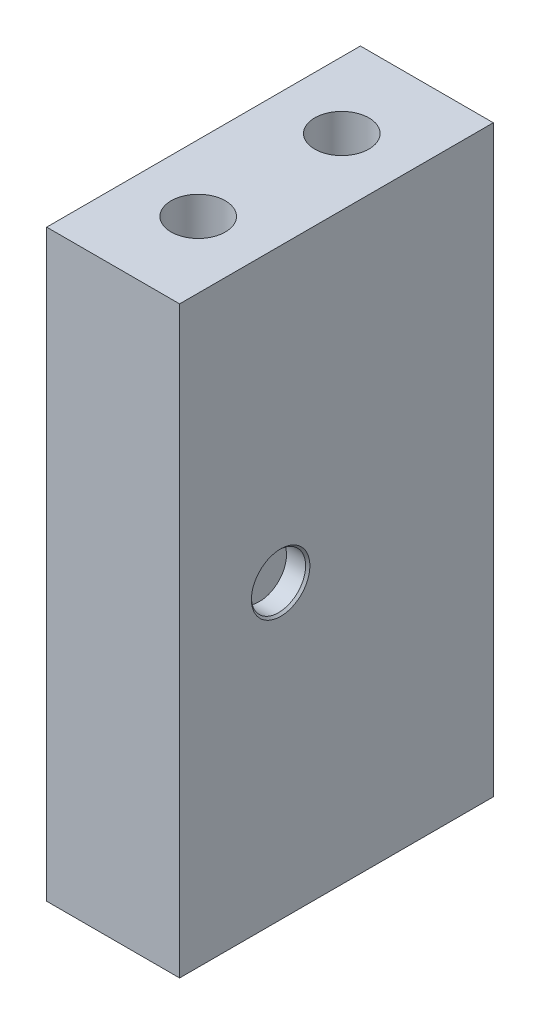
from build123d import *

# Parameters (mm, degrees)
SKETCH1_W           = 12.5
SKETCH1_H           = 29.5
SKETCH1_R           = 2.55
BOSS_EXTRUDE1_DEPTH = 27.45
SKETCH2_R           = 2.55
CUT_EXTRUDE1_DEPTH  = 2
CHAMFER1_SIZE       = 0.2


with BuildPart() as part:
    # Sketch1 → Boss-Extrude1 (new, symmetric)
    with BuildSketch(Plane(origin=(0, 0, 0), x_dir=(1, 0, 0), z_dir=(0, 1, 0))):
        Rectangle(SKETCH1_W, SKETCH1_H)
        with Locations((0, 6.75)):
            Circle(SKETCH1_R, mode=Mode.SUBTRACT)
        with Locations((0, -6.75)):
            Circle(SKETCH1_R, mode=Mode.SUBTRACT)
    extrude(amount=BOSS_EXTRUDE1_DEPTH, both=True)

    # Sketch2 → Cut-Extrude1 (cut)
    with BuildSketch(Plane(origin=(6.25, 0, 0), x_dir=(0, 0, -1), z_dir=(1, 0, 0))):
        with Locations((-5.25, 0)):
            Circle(SKETCH2_R)
    extrude(amount=-CUT_EXTRUDE1_DEPTH, mode=Mode.SUBTRACT)

    # Chamfer1
    chamfer1_edges = [part.edges().sort_by_distance(p)[0] for p in [
        (6.25, 0, 7.8),
    ]]
    chamfer(chamfer1_edges, length=CHAMFER1_SIZE)


solid = part.part
